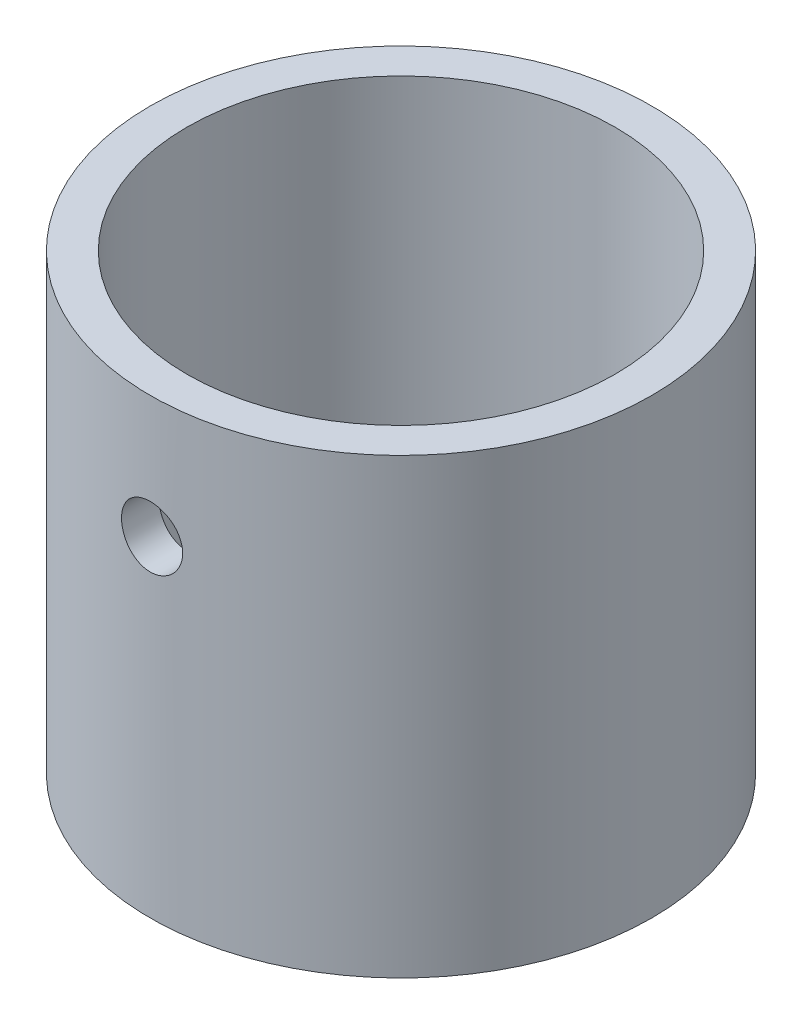
from build123d import *

# Parameters (mm, degrees)
SKETCH1_R           = 20.5
SKETCH1_R_2         = 17.5
EXTRUDE_THIN1_DEPTH = 37
CUT_EXTRUDE1_START  = 17.320381507
CUT_EXTRUDE1_DEPTH  = 3.179618529


# Read off the part's stored shape, not the designer's step: Cut-Extrude1
with BuildPart() as part:
    # Sketch1 → Extrude-Thin1 (new body)
    with BuildSketch(Plane(origin=(0, 0, 0), x_dir=(1, 0, 0), z_dir=(0, 1, 0))):
        Circle(SKETCH1_R)
        Circle(SKETCH1_R_2, mode=Mode.SUBTRACT)
    extrude(amount=EXTRUDE_THIN1_DEPTH)

    # Cut-Extrude1 outline → Cut-Extrude1 (cut)
    with BuildSketch(Plane.XY.offset(CUT_EXTRUDE1_START)):
        with BuildLine():
            add(Edge.make_bspline(
                [(-2.5, 27), (-2.5, 26.338444988), (-2.228225053, 25.692590791), (-1.306923592, 24.771490083), (-0.654490366, 24.500367844), (0.651677184, 24.499632947), (1.300892613, 24.765681051), (2.233419343, 25.697563516), (2.499750322, 26.346033507), (2.500249313, 27.65205615), (2.229910618, 28.304747367), (1.308975128, 29.227431519), (0.663224576, 29.499427935), (-0.65890479, 29.500570199), (-1.305581553, 29.229243688), (-2.227234734, 28.30900575), (-2.5, 27.661555012), (-2.5, 27)],
                knots=[0, 0, 0, 0, 0.125, 0.125, 0.25, 0.25, 0.375, 0.375, 0.5, 0.5, 0.625, 0.625, 0.75, 0.75, 0.875, 0.875, 1, 1, 1, 1], degree=3))
        make_face()
    extrude(amount=CUT_EXTRUDE1_DEPTH, mode=Mode.SUBTRACT)


solid = part.part
